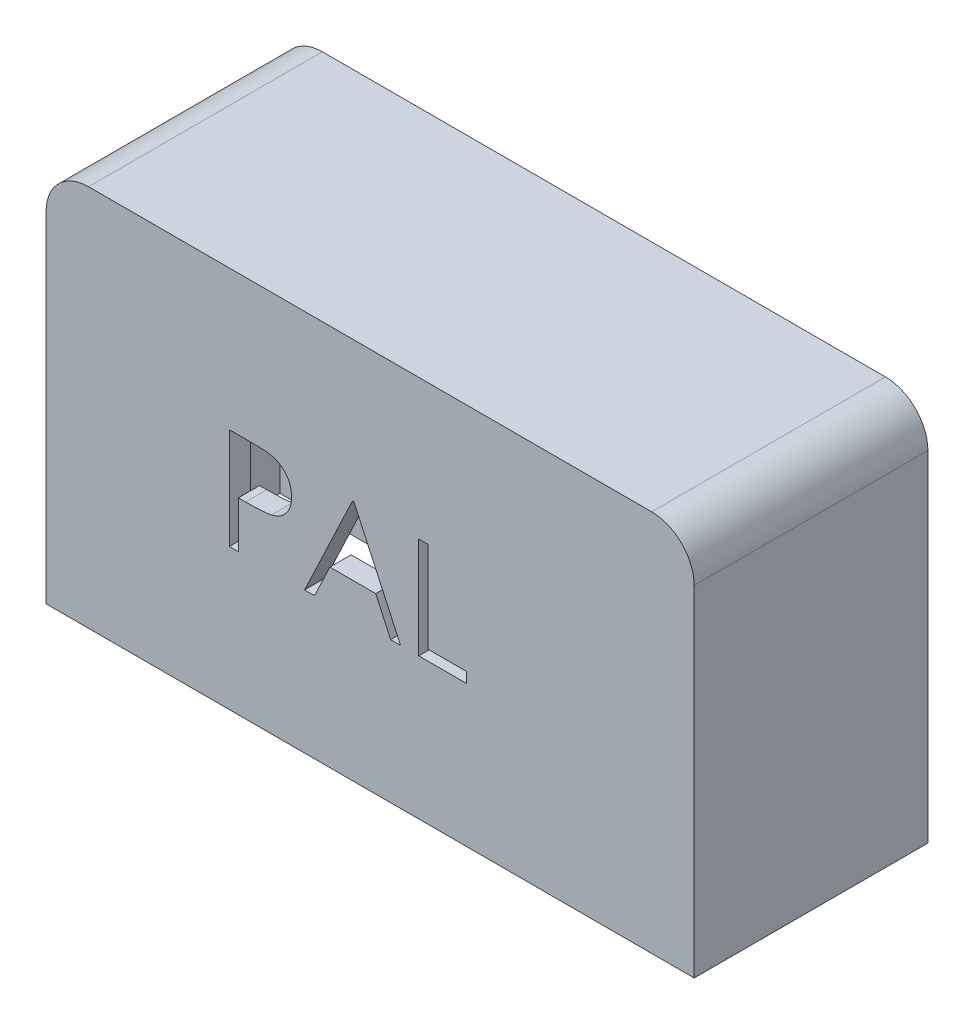
from build123d import *

# Parameters (mm, degrees)
SKETCH1_W           = 30.5
SKETCH1_H           = 18
BOSS_EXTRUDE1_DEPTH = 11
SKETCH3_W           = 28.5
SKETCH3_H           = 9
CUT_EXTRUDE2_DEPTH  = 16
SKETCH4_W           = 7
SKETCH4_H           = 7
CUT_EXTRUDE4_DEPTH  = 5
FILLET4_R           = 2
FILLET5_R           = 2
WRAP2_START         = -1
WRAP2_DEPTH         = 1


# Read off the part's stored shape, not the designer's step: Wrap2
with BuildPart() as part:
    # Sketch1 → Boss-Extrude1 (new body)
    with BuildSketch(Plane.XY):
        with Locations((15.25, 9)):
            Rectangle(SKETCH1_W, SKETCH1_H)
    extrude(amount=BOSS_EXTRUDE1_DEPTH)

    # Sketch3 → Cut-Extrude2 (cut)
    with BuildSketch(Plane(origin=(0, 0, 0), x_dir=(-1, 0, 0), z_dir=(0, -1, 0))):
        with Locations((-15.25, -5.5)):
            Rectangle(SKETCH3_W, SKETCH3_H)
    extrude(amount=-CUT_EXTRUDE2_DEPTH, mode=Mode.SUBTRACT)

    # Sketch4 → Cut-Extrude4 (cut)
    with BuildSketch(Plane(origin=(0, 0, 0), x_dir=(-1, 0, 0), z_dir=(0, 0, -1))):
        with Locations((-16.25, 12)):
            Rectangle(SKETCH4_W, SKETCH4_H)
    extrude(amount=-CUT_EXTRUDE4_DEPTH, mode=Mode.SUBTRACT)

    # Fillet4
    fillet4_edges = [part.edges().sort_by_distance(p)[0] for p in [
        (30.5, 18, 5.5),
    ]]
    fillet(fillet4_edges, radius=FILLET4_R)

    # Fillet5
    fillet5_edges = [part.edges().sort_by_distance(p)[0] for p in [
        (0, 18, 5.5),
    ]]
    fillet(fillet5_edges, radius=FILLET5_R)

    # Wrap2 outline → Wrap2 (cut)
    with BuildSketch(Plane.XY.offset(11).offset(WRAP2_START)):
        with BuildLine():
            add(Edge.make_bspline(
                [(9.556268529, 11.410544446), (9.620509083, 11.41047383), (9.743596838, 11.410338527), (9.920101968, 11.406236319), (10.080407352, 11.400757142), (10.224167335, 11.39316178), (10.35182424, 11.384185705), (10.462800423, 11.371596323), (10.557968176, 11.358451421), (10.61499088, 11.345087293), (10.640996594, 11.338992463)],
                knots=[0, 0, 0, 0, 0.176955752, 0.33905508, 0.486318225, 0.618780923, 0.735618828, 0.838742477, 0.926457068, 1, 1, 1, 1], degree=3))
            Line((9.556268529, 11.410544446), (8.622276642, 11.410544446))
            Line((8.622276642, 11.410544446), (8.622276642, 6.648044446))
            Line((8.622276642, 6.648044446), (9.049680488, 6.648044446))
            Line((9.049680488, 6.648044446), (9.049680488, 8.846121369))
            Line((9.049680488, 8.846121369), (9.390267928, 8.846121369))
            add(Edge.make_bspline(
                [(10.602835536, 8.924351537), (10.572998699, 8.918006552), (10.507609537, 8.904101149), (10.399918904, 8.888577499), (10.274535361, 8.875327406), (10.131630045, 8.865392644), (9.971331228, 8.856887679), (9.793552195, 8.850127522), (9.597943969, 8.846412971), (9.461503455, 8.846221392), (9.390267928, 8.846121369)],
                knots=[0, 0, 0, 0, 0.075173117, 0.164746258, 0.268016881, 0.385911876, 0.517789479, 0.663690977, 0.824413221, 1, 1, 1, 1], degree=3))
            add(Edge.make_bspline(
                [(11.553045872, 10.13310304), (11.552472434, 10.093944708), (11.551350462, 10.017328787), (11.537884445, 9.905242957), (11.519745863, 9.798129719), (11.491855231, 9.696226574), (11.45532594, 9.600138686), (11.412474254, 9.508397653), (11.360789522, 9.422564242), (11.301401379, 9.342326843), (11.23533653, 9.267610141), (11.162874497, 9.198955581), (11.084307817, 9.136765035), (10.999886179, 9.080899081), (10.908786564, 9.032653215), (10.812390633, 8.989440597), (10.709860517, 8.953148904), (10.638909454, 8.934057999), (10.602835536, 8.924351537)],
                knots=[0, 0, 0, 0, 0.070118894, 0.137192353, 0.202016181, 0.264631407, 0.326116547, 0.386010305, 0.445811847, 0.505297697, 0.564633278, 0.624282625, 0.683902032, 0.743952771, 0.805387731, 0.868388031, 0.933084028, 1, 1, 1, 1], degree=3))
            add(Edge.make_bspline(
                [(10.640996594, 11.338992463), (10.673917081, 11.329981881), (10.738982325, 11.312173041), (10.832736958, 11.276503653), (10.921937012, 11.234209707), (11.006888526, 11.186007846), (11.086547574, 11.129829989), (11.162102652, 11.067953387), (11.232886982, 10.998949432), (11.298502519, 10.923592068), (11.358761475, 10.843146353), (11.410645079, 10.756411391), (11.454088913, 10.664847153), (11.491349722, 10.568517329), (11.518167298, 10.466612996), (11.538369686, 10.35984222), (11.551192551, 10.248216445), (11.55242068, 10.171934982), (11.553045872, 10.13310304)],
                knots=[0, 0, 0, 0, 0.062481339, 0.123490383, 0.183411094, 0.243153221, 0.302126735, 0.361709671, 0.421842292, 0.482931901, 0.544552254, 0.60568072, 0.667679738, 0.729984388, 0.794550921, 0.86034562, 0.928907356, 1, 1, 1, 1], degree=3))
        make_face()
        Polygon((19.795834334, 7.136505985), (17.964103565, 7.136505985), (17.964103565, 11.410544446), (17.536699719, 11.410544446), (17.536699719, 6.648044446), (19.795834334, 6.648044446), align=None)
        Polygon((15.513209634, 8.174486754), (16.217281149, 6.648044446), (16.681892026, 6.648044446), (14.483815103, 11.410544446), (14.422757411, 11.410544446), (12.163622795, 6.648044446), (12.630141726, 6.648044446), (13.354247795, 8.174486754), align=None)
    extrude(amount=WRAP2_DEPTH, mode=Mode.SUBTRACT)


solid = part.part
